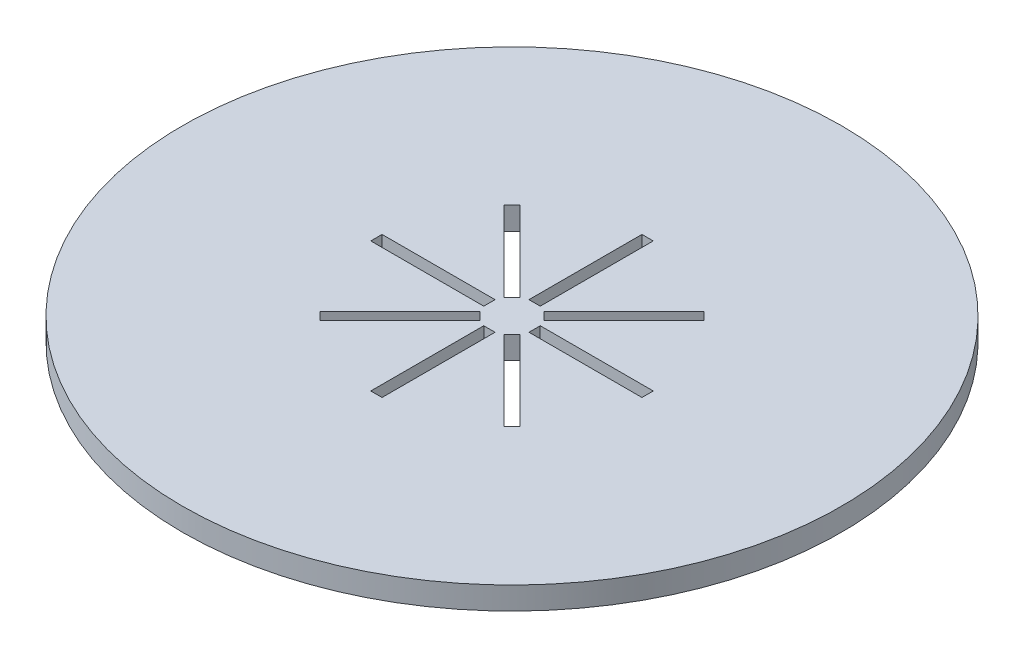
from build123d import *

# Parameters (mm, degrees)
SKETCH1_R          = 87.5
BASE_FLANGE1_DEPTH = 6
SKETCH4_W          = 30
SKETCH4_H          = 3
CUT_EXTRUDE1_DEPTH = 10
CIRPATTERN1_COUNT  = 8


# Sheet-metal steps are written as plain solids
with BuildPart() as part:
    # Sketch1 → Base-Flange1 (new body)
    with BuildSketch(Plane(origin=(0, 0, 0), x_dir=(1, 0, 0), z_dir=(0, 1, 0))):
        with Locations(Location((0, 0, 0), (0, 0, 270))):
            Circle(SKETCH1_R)
    extrude(amount=-BASE_FLANGE1_DEPTH)

    # Sketch4 → Cut-Extrude1 (cut)
    with BuildSketch(Plane(origin=(0, 0, 0), x_dir=(1, 0, 0), z_dir=(0, 1, 0))):
        with Locations((-21, 0)):
            Rectangle(SKETCH4_W, SKETCH4_H)
    cut_extrude1 = extrude(amount=-CUT_EXTRUDE1_DEPTH, mode=Mode.SUBTRACT)

    # CirPattern1: Cut-Extrude1 ×8 about axis
    cirpattern1_axis = Axis((0, 0, 0), (0, 1, 0))
    for i in range(1, CIRPATTERN1_COUNT):
        add(cut_extrude1.rotate(cirpattern1_axis, i * 360 / CIRPATTERN1_COUNT), mode=Mode.SUBTRACT)


solid = part.part
